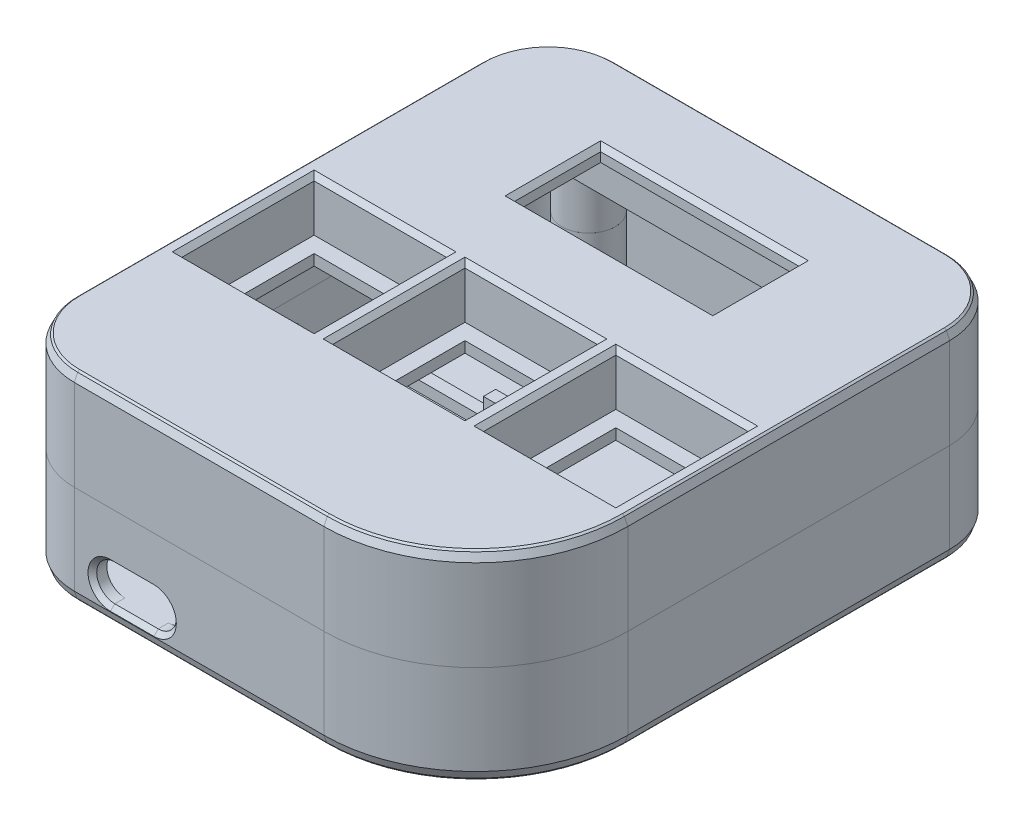
from build123d import *
from OCP.BRepFilletAPI import BRepFilletAPI_MakeChamfer

# Parameters (mm, degrees)
SKETCH2_W                                      = 65
SKETCH2_H                                      = 75
BODY_EXTRUDE_DEPTH                             = 27.5
SMALL_CORNERS_R                                = 9.5
ACCENT_CORNER_R                                = 21
SHELL1_T                                       = 2
E_MOUNTING_START                               = 5
SKETCH4_R                                      = 1.4
E_MOUNTING_DEPTH                               = 5
SKETCH6_W                                      = 10
SKETCH6_H                                      = 1.7
SKETCH6_W_2                                    = 1.7
SKETCH6_H_2                                    = 9.5
WIRE_ROUTES_DEPTH                              = 2.5
MIC_OPENING_REACH                              = 57.792
SKETCH5_R                                      = 1.25
FRONT_CUTOUTS_REACH                            = 58.734
SKETCH11_W                                     = 27.5
SKETCH11_H                                     = 12
SKETCH11_W_2                                   = 18.4
SKETCH11_H_2                                   = 18.4
SKETCH12_W                                     = 18.4
SKETCH12_H                                     = 18.4
SWITCH_SUPPORTS_DEPTH                          = 5.2
SKETCH13_W                                     = 14
SKETCH13_H                                     = 14
SWITCH_MOUNTS_DEPTH                            = 1.5
SKETCH14_W                                     = 61
SKETCH14_H                                     = 1.2
SCREEN_RETAINERS_DEPTH                         = 4
BED_CHAMFER_SIZE                               = 0.6
BED_CHAMFER_SIZE2                              = 0.715052156
CSK_FOR_M3_FLAT_HEAD_MACHINE_SCREW1_AT_2_COUNT = 2
CSK_FOR_M3_FLAT_HEAD_MACHINE_SCREW1_AT_2_PITCH = 41
CSK_FOR_M3_FLAT_HEAD_MACHINE_SCREW1_AT_3_COUNT = 2
CSK_FOR_M3_FLAT_HEAD_MACHINE_SCREW1_AT_3_PITCH = 71.676438543
USB_C_REACH                                    = 86.507
SCREW_POSTS_REACH                              = 57.792
SKETCH8_R                                      = 3.7
SKETCH8_R_2                                    = 1.7
POST_CHAMFERS_SIZE                             = 4.65
POST_CHAMFERS_SIZE_2                           = 1
POWER_SWITCH_SLOT_REACH                        = 80.304
SKETCH17_W                                     = 5.8
SKETCH17_H                                     = 4.8
SWITCH_SPACER_DEPTH                            = 3.4
SWITCH_MOUNT_DEPTH                             = 7
SKETCH23_W                                     = 1.4
SKETCH23_H                                     = 12.4
SWITCH_RETAINER_1_DEPTH                        = 2.5
SWITCH_RETAINER_2_DEPTH                        = 0.4
INTERNAL_CHAMFERS_SIZE                         = 1
PORT_CHAMFER_SIZE                              = 0.6
SKETCH27_R                                     = 2.5
HEATSET_INSERTS_DEPTH                          = 11.75


with BuildPart() as part:
    # Sketch2 → Body Extrude (new body)
    with BuildSketch(Plane(origin=(0, 0, 0), x_dir=(1, 0, 0), z_dir=(0, 1, 0))):
        Rectangle(SKETCH2_W, SKETCH2_H)
    extrude(amount=BODY_EXTRUDE_DEPTH)

    # Small Corners
    small_corners_edges = [part.edges().sort_by_distance(p)[0] for p in [
        (-32.5, 13.75, 37.5),
        (-32.5, 13.75, -37.5),
        (32.5, 13.75, -37.5),
    ]]
    fillet(small_corners_edges, radius=SMALL_CORNERS_R)

    # Accent Corner
    accent_corner_edges = [part.edges().sort_by_distance(p)[0] for p in [
        (32.5, 13.75, 37.5),
    ]]
    fillet(accent_corner_edges, radius=ACCENT_CORNER_R)

    # Shell1 (no face opened: a closed hollow body)
    add(offset(amount=-SHELL1_T, mode=Mode.PRIVATE), mode=Mode.SUBTRACT)

    # Sketch4 → E-Mounting (add)
    with BuildSketch(Plane(origin=(0, 2, 0), x_dir=(1, 0, 0), z_dir=(0, 1, 0)).offset(E_MOUNTING_START)):
        with Locations(Location((-22.575, 23.5, 0), (0, 0, 90))):
            Circle(SKETCH4_R)
        with Locations(Location((-12.125, 23.5, 0), (0, 0, 90))):
            Circle(SKETCH4_R)
        with BuildLine():
            Line((-7, 27.2), (-5.3, 27.2))
            Line((-5.3, 27.2), (-5.3, -35.5))
            Line((-5.3, -35.5), (-7, -35.5))
            Line((-7, -35.5), (-7, -13.928416147))
            Line((-7, -13.928416147), (-25.2, -13.928416147))
            Line((-25.2, -13.928416147), (-25.2, -35.170076708))
            ThreePointArc((-25.2, -35.170076708), (-29.031169041, -32.458138625), (-30.5, -28))
            Line((-30.5, -28), (-30.5, -12.228416147))
            Line((-30.5, -12.228416147), (-7, -12.228416147))
            Line((-7, -12.228416147), (-7, 8.4))
            Line((-7, 8.4), (-30.5, 8.4))
            Line((-30.5, 8.4), (-30.5, 10.1))
            Line((-30.5, 10.1), (-7, 10.1))
            Line((-7, 10.1), (-7, 27.2))
        make_face()
        with BuildLine():
            Line((25.2, 27.2), (26.9, 27.2))
            Line((26.9, 27.2), (26.9, -27.628342195))
            ThreePointArc((26.9, -27.628342195), (26.085582413, -28.676238568), (25.2, -29.664725595))
            Line((25.2, -29.664725595), (25.2, 27.2))
        make_face()
    extrude(amount=-E_MOUNTING_DEPTH)

    # Sketch6 → Wire Routes (cut)
    with BuildSketch(Plane(origin=(0, 7, 0), x_dir=(1, 0, 0), z_dir=(0, 1, 0))):
        with Locations((-16.1, -13.078416147)):
            Rectangle(SKETCH6_W, SKETCH6_H)
        with Locations((-6.15, -30.75)):
            Rectangle(SKETCH6_W_2, SKETCH6_H_2)
        with Locations((-17.35, 9.25)):
            Rectangle(SKETCH6_W, SKETCH6_H)
    extrude(amount=-WIRE_ROUTES_DEPTH, mode=Mode.SUBTRACT)

    # Sketch5 → Mic Opening (cut, up to next)
    with BuildSketch(Plane(origin=(0, 2, 0), x_dir=(1, 0, 0), z_dir=(0, 1, 0)), mode=Mode.PRIVATE) as mic_opening_sk1:
        with Locations(Location((-17.35, 23.5, 0), (0, 0, 270))):
            Circle(SKETCH5_R)
    mic_opening_tool1 = extrude(mic_opening_sk1.sketch, amount=-MIC_OPENING_REACH, mode=Mode.PRIVATE) & part.part
    add(mic_opening_tool1.solids().sort_by_distance((-17.35, 2, -23.5))[0], mode=Mode.SUBTRACT)

    # Sketch11 → Front Cutouts (cut, up to next)
    with BuildSketch(Plane(origin=(0, 27.5, 0), x_dir=(1, 0, 0), z_dir=(0, 1, 0)), mode=Mode.PRIVATE) as front_cutouts_sk1:
        with Locations((0, 20)):
            Rectangle(SKETCH11_W, SKETCH11_H)
    front_cutouts_tool1 = extrude(front_cutouts_sk1.sketch, amount=-FRONT_CUTOUTS_REACH, mode=Mode.PRIVATE) & part.part
    # Sketch11 → Front Cutouts (cut, up to next)
    with BuildSketch(Plane(origin=(0, 27.5, 0), x_dir=(1, 0, 0), z_dir=(0, 1, 0)), mode=Mode.PRIVATE) as front_cutouts_sk2:
        with Locations((-20.85, -6.5)):
            Rectangle(SKETCH11_W_2, SKETCH11_H_2)
    front_cutouts_tool2 = extrude(front_cutouts_sk2.sketch, amount=-FRONT_CUTOUTS_REACH, mode=Mode.PRIVATE) & part.part
    # Sketch11 → Front Cutouts (cut, up to next)
    with BuildSketch(Plane(origin=(0, 27.5, 0), x_dir=(1, 0, 0), z_dir=(0, 1, 0)), mode=Mode.PRIVATE) as front_cutouts_sk3:
        with Locations((0, -6.5)):
            Rectangle(SKETCH11_W_2, SKETCH11_H_2)
    front_cutouts_tool3 = extrude(front_cutouts_sk3.sketch, amount=-FRONT_CUTOUTS_REACH, mode=Mode.PRIVATE) & part.part
    # Sketch11 → Front Cutouts (cut, up to next)
    with BuildSketch(Plane(origin=(0, 27.5, 0), x_dir=(1, 0, 0), z_dir=(0, 1, 0)), mode=Mode.PRIVATE) as front_cutouts_sk4:
        with Locations((20.85, -6.5)):
            Rectangle(SKETCH11_W_2, SKETCH11_H_2)
    front_cutouts_tool4 = extrude(front_cutouts_sk4.sketch, amount=-FRONT_CUTOUTS_REACH, mode=Mode.PRIVATE) & part.part
    add(front_cutouts_tool1.solids().sort_by_distance((0, 27.5, -20))[0], mode=Mode.SUBTRACT)
    add(front_cutouts_tool2.solids().sort_by_distance((-20.85, 27.5, 6.5))[0], mode=Mode.SUBTRACT)
    add(front_cutouts_tool3.solids().sort_by_distance((0, 27.5, 6.5))[0], mode=Mode.SUBTRACT)
    add(front_cutouts_tool4.solids().sort_by_distance((20.85, 27.5, 6.5))[0], mode=Mode.SUBTRACT)

    # Sketch12 → Switch Supports (add)
    with BuildSketch(Plane.XZ.offset(-25.5)):
        with BuildLine():
            Line((-30.5, 18.2), (-30.5, -5.2))
            Line((-30.5, -5.2), (30.5, -5.2))
            Line((30.5, -5.2), (30.5, 16.5))
            ThreePointArc((30.5, 16.5), (30.480939075, 17.350853582), (30.423794545, 18.2))
            Line((30.423794545, 18.2), (-30.5, 18.2))
        make_face()
        with Locations((-20.85, 6.5)):
            Rectangle(SKETCH12_W, SKETCH12_H, mode=Mode.SUBTRACT)
        with Locations((0, 6.5)):
            Rectangle(SKETCH12_W, SKETCH12_H, mode=Mode.SUBTRACT)
        with Locations((20.85, 6.5)):
            Rectangle(SKETCH12_W, SKETCH12_H, mode=Mode.SUBTRACT)
    extrude(amount=SWITCH_SUPPORTS_DEPTH)

    # Sketch13 → Switch Mounts (add)
    with BuildSketch(Plane.XZ.offset(-20.3)):
        with BuildLine():
            Line((-30.5, -5.2), (30.5, -5.2))
            Line((30.5, -5.2), (30.5, 16.5))
            ThreePointArc((30.5, 16.5), (30.480939075, 17.350853582), (30.423794545, 18.2))
            Line((30.423794545, 18.2), (-30.5, 18.2))
            Line((-30.5, 18.2), (-30.5, -5.2))
        make_face()
        with Locations((-20.85, 6.5)):
            Rectangle(SKETCH13_W, SKETCH13_H, mode=Mode.SUBTRACT)
        with Locations((0, 6.5)):
            Rectangle(SKETCH13_W, SKETCH13_H, mode=Mode.SUBTRACT)
        with Locations((20.85, 6.5)):
            Rectangle(SKETCH13_W, SKETCH13_H, mode=Mode.SUBTRACT)
    extrude(amount=SWITCH_MOUNTS_DEPTH)

    # Sketch14 → Screen Retainers (add)
    with BuildSketch(Plane.XZ.offset(-25.5)):
        with Locations((0, -13.2)):
            Rectangle(SKETCH14_W, SKETCH14_H)
        with Locations((0, -26.8)):
            Rectangle(SKETCH14_W, SKETCH14_H)
    extrude(amount=SCREEN_RETAINERS_DEPTH)

    # Bed Chamfer: one chamfer whose edges measure the first distance from different faces: ONE call of the kernel's chamfer builder (chamfer() names one face for all edges)
    bed_chamfer_edges_1 = [part.edges().sort_by_distance(p)[0] for p in [
        (0, 0, -37.5),
        (-5.75, 0, 37.5),
        (-32.5, 0, 0),
        (-29.717514421, 0, -34.717514421),
        (-29.717514421, 0, 34.717514421),
        (29.717514421, 0, -34.717514421),
        (32.5, 0, -5.75),
        (26.349242405, 0, 31.349242405),
    ]]
    bed_chamfer_side_1 = [part.faces().sort_by_distance(p)[0] for p in [
        (-0.41513385, 0, -0.488516013),
    ]]
    bed_chamfer_edges_2 = [part.edges().sort_by_distance(p)[0] for p in [
        (0, 27.5, -37.5),
    ]]
    bed_chamfer_side_2 = [part.faces().sort_by_distance(p)[0] for p in [
        (0, 13.75, -37.5),
    ]]
    bed_chamfer_edges_3 = [part.edges().sort_by_distance(p)[0] for p in [
        (-17.35, 0, -24.75),
    ]]
    bed_chamfer_side_3 = [part.faces().sort_by_distance(p)[0] for p in [
        (-17.35, 1, -24.75),
    ]]
    bed_chamfer_edges_4 = [part.edges().sort_by_distance(p)[0] for p in [
        (-13.75, 27.5, -20),
        (0, 27.5, -14),
        (13.75, 27.5, -20),
        (0, 27.5, -26),
        (-30.05, 27.5, 6.5),
        (-20.85, 27.5, 15.7),
        (-11.65, 27.5, 6.5),
        (-20.85, 27.5, -2.7),
        (-9.2, 27.5, 6.5),
        (0, 27.5, 15.7),
        (9.2, 27.5, 6.5),
        (0, 27.5, -2.7),
        (11.65, 27.5, 6.5),
        (20.85, 27.5, 15.7),
        (30.05, 27.5, 6.5),
        (20.85, 27.5, -2.7),
    ]]
    bed_chamfer_side_4 = [part.faces().sort_by_distance(p)[0] for p in [
        (-5.75, 27.5, 36.507528338),
    ]]
    bed_chamfer_edges_5 = [part.edges().sort_by_distance(p)[0] for p in [
        (-32.5, 27.5, 0),
    ]]
    bed_chamfer_side_5 = [part.faces().sort_by_distance(p)[0] for p in [
        (-32.5, 13.75, 0),
    ]]
    bed_chamfer_edges_6 = [part.edges().sort_by_distance(p)[0] for p in [
        (-5.75, 27.5, 37.5),
    ]]
    bed_chamfer_side_6 = [part.faces().sort_by_distance(p)[0] for p in [
        (-5.75, 13.75, 37.5),
    ]]
    bed_chamfer_edges_7 = [part.edges().sort_by_distance(p)[0] for p in [
        (-29.717514421, 27.5, -34.717514421),
    ]]
    bed_chamfer_side_7 = [part.faces().sort_by_distance(p)[0] for p in [
        (-29.717514421, 13.75, -34.717514421),
    ]]
    bed_chamfer_edges_8 = [part.edges().sort_by_distance(p)[0] for p in [
        (-29.717514421, 27.5, 34.717514421),
    ]]
    bed_chamfer_side_8 = [part.faces().sort_by_distance(p)[0] for p in [
        (-29.717514421, 13.75, 34.717514421),
    ]]
    bed_chamfer_edges_9 = [part.edges().sort_by_distance(p)[0] for p in [
        (29.717514421, 27.5, -34.717514421),
    ]]
    bed_chamfer_side_9 = [part.faces().sort_by_distance(p)[0] for p in [
        (29.717514421, 13.75, -34.717514421),
    ]]
    bed_chamfer_edges_10 = [part.edges().sort_by_distance(p)[0] for p in [
        (32.5, 27.5, -5.75),
    ]]
    bed_chamfer_side_10 = [part.faces().sort_by_distance(p)[0] for p in [
        (32.5, 13.75, -5.75),
    ]]
    bed_chamfer_edges_11 = [part.edges().sort_by_distance(p)[0] for p in [
        (26.349242405, 27.5, 31.349242405),
    ]]
    bed_chamfer_side_11 = [part.faces().sort_by_distance(p)[0] for p in [
        (26.349242405, 13.75, 31.349242405),
    ]]
    bed_chamfer = BRepFilletAPI_MakeChamfer(part.part.solid().wrapped)
    for e in bed_chamfer_edges_1:
        bed_chamfer.Add(BED_CHAMFER_SIZE, BED_CHAMFER_SIZE2, e.wrapped, bed_chamfer_side_1[0].wrapped)  # the first distance lies on this face
    for e in bed_chamfer_edges_2:
        bed_chamfer.Add(BED_CHAMFER_SIZE, BED_CHAMFER_SIZE2, e.wrapped, bed_chamfer_side_2[0].wrapped)  # the first distance lies on this face
    for e in bed_chamfer_edges_3:
        bed_chamfer.Add(BED_CHAMFER_SIZE, BED_CHAMFER_SIZE2, e.wrapped, bed_chamfer_side_3[0].wrapped)  # the first distance lies on this face
    for e in bed_chamfer_edges_4:
        bed_chamfer.Add(BED_CHAMFER_SIZE, BED_CHAMFER_SIZE2, e.wrapped, bed_chamfer_side_4[0].wrapped)  # the first distance lies on this face
    for e in bed_chamfer_edges_5:
        bed_chamfer.Add(BED_CHAMFER_SIZE, BED_CHAMFER_SIZE2, e.wrapped, bed_chamfer_side_5[0].wrapped)  # the first distance lies on this face
    for e in bed_chamfer_edges_6:
        bed_chamfer.Add(BED_CHAMFER_SIZE, BED_CHAMFER_SIZE2, e.wrapped, bed_chamfer_side_6[0].wrapped)  # the first distance lies on this face
    for e in bed_chamfer_edges_7:
        bed_chamfer.Add(BED_CHAMFER_SIZE, BED_CHAMFER_SIZE2, e.wrapped, bed_chamfer_side_7[0].wrapped)  # the first distance lies on this face
    for e in bed_chamfer_edges_8:
        bed_chamfer.Add(BED_CHAMFER_SIZE, BED_CHAMFER_SIZE2, e.wrapped, bed_chamfer_side_8[0].wrapped)  # the first distance lies on this face
    for e in bed_chamfer_edges_9:
        bed_chamfer.Add(BED_CHAMFER_SIZE, BED_CHAMFER_SIZE2, e.wrapped, bed_chamfer_side_9[0].wrapped)  # the first distance lies on this face
    for e in bed_chamfer_edges_10:
        bed_chamfer.Add(BED_CHAMFER_SIZE, BED_CHAMFER_SIZE2, e.wrapped, bed_chamfer_side_10[0].wrapped)  # the first distance lies on this face
    for e in bed_chamfer_edges_11:
        bed_chamfer.Add(BED_CHAMFER_SIZE, BED_CHAMFER_SIZE2, e.wrapped, bed_chamfer_side_11[0].wrapped)  # the first distance lies on this face
    add(Compound.cast(bed_chamfer.Shape()), mode=Mode.REPLACE)

    # Sketch7 → CSK for M3 Flat Head Machine Screw1 (revolve, cut)
    with BuildSketch(Plane(origin=(-20.5, 0, -31.076084879), x_dir=(0, 0, -1), z_dir=(1, 0, 0))):
        Polygon((0, 0), (0, 2), (1.7, 2), (1.7, 1.45), (3.15, 0), align=None)
    csk_for_m3_flat_head_machine_screw1 = revolve(axis=Axis((-20.5, -6.35, -31.076084879), (0, 1, 0)), mode=Mode.SUBTRACT)

    # CSK for M3 Flat Head Machine Screw1 at 2: CSK for M3 Flat Head Machine Screw1 ×2
    with Locations(*[(i * CSK_FOR_M3_FLAT_HEAD_MACHINE_SCREW1_AT_2_PITCH, 0, 0) for i in range(1, CSK_FOR_M3_FLAT_HEAD_MACHINE_SCREW1_AT_2_COUNT)]):
        add(csk_for_m3_flat_head_machine_screw1, mode=Mode.SUBTRACT)

    # CSK for M3 Flat Head Machine Screw1 at 3: CSK for M3 Flat Head Machine Screw1 ×2
    with Locations(*[Vector(0.49528130472774157, 0, 0.868732656913038) * (i * CSK_FOR_M3_FLAT_HEAD_MACHINE_SCREW1_AT_3_PITCH) for i in range(1, CSK_FOR_M3_FLAT_HEAD_MACHINE_SCREW1_AT_3_COUNT)]):
        add(csk_for_m3_flat_head_machine_screw1, mode=Mode.SUBTRACT)

    # Sketch10 → USB-C (cut, up to next)
    with BuildSketch(Plane(origin=(0, 0, 35.5), x_dir=(-1, 0, 0), z_dir=(0, 0, -1)), mode=Mode.PRIVATE) as usb_c_sk1:
        with BuildLine():
            Line((12, 7), (18, 7))
            ThreePointArc((18, 7), (20.5, 4.5), (18, 2))
            Line((18, 2), (12, 2))
            ThreePointArc((12, 2), (9.5, 4.5), (12, 7))
        make_face()
    usb_c_tool1 = extrude(usb_c_sk1.sketch, amount=-USB_C_REACH, mode=Mode.PRIVATE) & part.part
    add(usb_c_tool1.solids().sort_by_distance((-15, 4.5, 35.5))[0], mode=Mode.SUBTRACT)

    # Sketch8 → Screw Posts (add, up to next)
    with BuildSketch(Plane(origin=(0, 2, 0), x_dir=(1, 0, 0), z_dir=(0, 1, 0)), mode=Mode.PRIVATE) as screw_posts_sk1:
        with Locations(Location((20.5, 31.076084879, 0), (0, 0, 90))):
            Circle(SKETCH8_R)
        with Locations(Location((20.5, 31.076084879, 0), (0, 0, 90))):
            Circle(SKETCH8_R_2, mode=Mode.SUBTRACT)
    screw_posts_tool1 = extrude(screw_posts_sk1.sketch, amount=SCREW_POSTS_REACH, mode=Mode.PRIVATE) - part.part
    # Sketch8 → Screw Posts (add, up to next)
    with BuildSketch(Plane(origin=(0, 2, 0), x_dir=(1, 0, 0), z_dir=(0, 1, 0)), mode=Mode.PRIVATE) as screw_posts_sk2:
        with Locations(Location((15, -31.191578015, 0), (0, 0, 90))):
            Circle(SKETCH8_R)
        with Locations(Location((15, -31.191578015, 0), (0, 0, 90))):
            Circle(SKETCH8_R_2, mode=Mode.SUBTRACT)
    screw_posts_tool2 = extrude(screw_posts_sk2.sketch, amount=SCREW_POSTS_REACH, mode=Mode.PRIVATE) - part.part
    # Sketch8 → Screw Posts (add, up to next)
    with BuildSketch(Plane(origin=(0, 2, 0), x_dir=(1, 0, 0), z_dir=(0, 1, 0)), mode=Mode.PRIVATE) as screw_posts_sk3:
        with Locations(Location((-20.5, 31.076084879, 0), (0, 0, 90))):
            Circle(SKETCH8_R)
        with Locations(Location((-20.5, 31.076084879, 0), (0, 0, 90))):
            Circle(SKETCH8_R_2, mode=Mode.SUBTRACT)
    screw_posts_tool3 = extrude(screw_posts_sk3.sketch, amount=SCREW_POSTS_REACH, mode=Mode.PRIVATE) - part.part
    add(screw_posts_tool1.solids().sort_by_distance((20.5, 2, -27.480737))[0])
    add(screw_posts_tool2.solids().sort_by_distance((15, 2, 34.786926))[0])
    add(screw_posts_tool3.solids().sort_by_distance((-20.5, 2, -27.480737))[0])

    # Post Chamfers
    # the kernel refuses this chamfer: 4.65, 1 mm, written as the material it adds along each edge
    with BuildSketch(Plane(origin=(20.5, 25.5, -31.076084879), x_dir=(0, 0, -1), z_dir=(-1, 0, 0))) as post_chamfers_piece_1_section:
        Polygon((3.7, POST_CHAMFERS_SIZE), (3.7 + POST_CHAMFERS_SIZE_2, 0), (3.7, 0), align=None)
    post_chamfers_piece_1 = revolve(axis=Axis((20.5, 25.5, -31.076084879), (0, -1, 0)), revolution_arc=359.64, mode=Mode.PRIVATE)
    post_chamfers_piece_1 = split(post_chamfers_piece_1, bisect_by=Plane(origin=(23.790006499, 21.512228263, -27.4), z_dir=(0, 0, -1)), keep=Keep.TOP, mode=Mode.PRIVATE)
    add(post_chamfers_piece_1)
    with BuildSketch(Plane(origin=(20.5, 25.5, -31.076084879), x_dir=(0, 0, -1), z_dir=(-1, 0, 0))) as post_chamfers_piece_2_section:
        Polygon((3.7, POST_CHAMFERS_SIZE), (3.7 + POST_CHAMFERS_SIZE_2, 0), (3.7, 0), align=None)
    post_chamfers_piece_2 = revolve(axis=Axis((20.5, 25.5, -31.076084879), (0, -1, 0)), revolution_arc=359.64, mode=Mode.PRIVATE)
    post_chamfers_piece_2 = split(post_chamfers_piece_2, bisect_by=Plane(origin=(20.5, 24.260006858, -27.4), z_dir=(0, 0, 1)), keep=Keep.TOP, mode=Mode.PRIVATE)
    add(post_chamfers_piece_2)
    with BuildSketch(Plane(origin=(-20.5, 25.5, -31.076084879), x_dir=(0, 0, -1), z_dir=(-1, 0, 0))) as post_chamfers_piece_3_section:
        Polygon((3.7 + POST_CHAMFERS_SIZE_2, 0), (3.7, POST_CHAMFERS_SIZE), (3.7, 0), align=None)
    post_chamfers_piece_3 = revolve(axis=Axis((-20.5, 25.5, -31.076084879), (0, -1, 0)), revolution_arc=359.64, mode=Mode.PRIVATE)
    post_chamfers_piece_3 = split(post_chamfers_piece_3, bisect_by=Plane(origin=(-16.587864302, 24.854685044, -27.4), z_dir=(0, 0, -1)), keep=Keep.TOP, mode=Mode.PRIVATE)
    add(post_chamfers_piece_3)
    with BuildSketch(Plane(origin=(-20.5, 25.5, -31.076084879), x_dir=(0, 0, -1), z_dir=(-1, 0, 0))) as post_chamfers_piece_4_section:
        Polygon((3.7 + POST_CHAMFERS_SIZE_2, 0), (3.7, POST_CHAMFERS_SIZE), (3.7, 0), align=None)
    post_chamfers_piece_4 = revolve(axis=Axis((-20.5, 25.5, -31.076084879), (0, -1, 0)), revolution_arc=359.64, mode=Mode.PRIVATE)
    post_chamfers_piece_4 = split(post_chamfers_piece_4, bisect_by=Plane(origin=(-20.5, 24.260007171, -27.4), z_dir=(0, 0, 1)), keep=Keep.TOP, mode=Mode.PRIVATE)
    add(post_chamfers_piece_4)
    with BuildSketch(Plane(origin=(20.5, 2, -31.076084879), x_dir=(0, 0, -1), z_dir=(1, 0, 0))) as post_chamfers_piece_5:
        Polygon((3.7 + POST_CHAMFERS_SIZE_2, 0), (3.7, POST_CHAMFERS_SIZE), (3.7, 0), align=None)
    revolve(axis=Axis((20.5, 2, -31.076084879), (0, 1, 0)))
    with BuildSketch(Plane(origin=(15, 2, 31.191578015), x_dir=(0, 0, -1), z_dir=(1, 0, 0))) as post_chamfers_piece_6:
        Polygon((3.7 + POST_CHAMFERS_SIZE_2, 0), (3.7, POST_CHAMFERS_SIZE), (3.7, 0), align=None)
    revolve(axis=Axis((15, 2, 31.191578015), (0, 1, 0)))
    with BuildSketch(Plane(origin=(-20.5, 2, -31.076084879), x_dir=(0, 0, -1), z_dir=(1, 0, 0))) as post_chamfers_piece_7:
        Polygon((3.7 + POST_CHAMFERS_SIZE_2, 0), (3.7, POST_CHAMFERS_SIZE), (3.7, 0), align=None)
    revolve(axis=Axis((-20.5, 2, -31.076084879), (0, 1, 0)))
    with BuildSketch(Plane(origin=(15, 25.5, 31.191578015), x_dir=(0, 0, -1), z_dir=(-1, 0, 0))) as post_chamfers_piece_8:
        Polygon((3.7, POST_CHAMFERS_SIZE), (3.7 + POST_CHAMFERS_SIZE_2, 0), (3.7, 0), align=None)
    revolve(axis=Axis((15, 25.5, 31.191578015), (0, -1, 0)))
    with BuildSketch(Plane(origin=(-20.5, 25.5, -31.076084879), x_dir=(0.006283143965558952, 0, -0.9999802608561371), z_dir=(-0.9999802608561371, 0, -0.006283143965558952))) as post_chamfers_piece_9_section:
        Polygon((-3.7 - POST_CHAMFERS_SIZE_2, 0), (-3.7, POST_CHAMFERS_SIZE), (-3.7, 0), align=None)
    post_chamfers_piece_9 = revolve(axis=Axis((-20.5, 25.5, -31.076084879), (0, -1, 0)), revolution_arc=359.64, mode=Mode.PRIVATE)
    post_chamfers_piece_9 = split(post_chamfers_piece_9, bisect_by=Plane(origin=(-20.486985966, 23.18736508, -27.4), z_dir=(0, 0, -1)), keep=Keep.TOP, mode=Mode.PRIVATE)
    add(post_chamfers_piece_9)
    with BuildSketch(Plane(origin=(20.5, 25.5, -31.076084879), x_dir=(0.006283143965559912, 0, -0.9999802608561371), z_dir=(-0.9999802608561371, 0, -0.006283143965559912))) as post_chamfers_piece_10_section:
        Polygon((-3.7, POST_CHAMFERS_SIZE), (-3.7 - POST_CHAMFERS_SIZE_2, 0), (-3.7, 0), align=None)
    post_chamfers_piece_10 = revolve(axis=Axis((20.5, 25.5, -31.076084879), (0, -1, 0)), revolution_arc=359.64, mode=Mode.PRIVATE)
    post_chamfers_piece_10 = split(post_chamfers_piece_10, bisect_by=Plane(origin=(20.513014034, 23.18736508, -27.4), z_dir=(0, 0, -1)), keep=Keep.TOP, mode=Mode.PRIVATE)
    add(post_chamfers_piece_10)

    # Sketch17 → Power Switch Slot (cut, up to next)
    with BuildSketch(Plane(origin=(-30.5, 0, 0), x_dir=(0, 0, -1), z_dir=(1, 0, 0)), mode=Mode.PRIVATE) as power_switch_slot_sk1:
        with Locations((-2, 8)):
            Rectangle(SKETCH17_W, SKETCH17_H)
    power_switch_slot_tool1 = extrude(power_switch_slot_sk1.sketch, amount=-POWER_SWITCH_SLOT_REACH, mode=Mode.PRIVATE) & part.part
    add(power_switch_slot_tool1.solids().sort_by_distance((-30.5, 8, 2))[0], mode=Mode.SUBTRACT)

    # Sketch21 → Switch Spacer (add)
    with BuildSketch(Plane(origin=(-30.5, 0, 0), x_dir=(0, 0, -1), z_dir=(1, 0, 0))):
        Polygon((-8.2, 8), (-4, 8), (-4, 6), (0, 6), (0, 8), (4.2, 8), (4.2, 2), (-8.2, 2), align=None)
    extrude(amount=SWITCH_SPACER_DEPTH)

    # Sketch20 → Switch Mount (add)
    with BuildSketch(Plane(origin=(-27.1, 0, 0), x_dir=(0, 0, -1), z_dir=(1, 0, 0))):
        Polygon((-5.7, 8), (-8.2, 8), (-8.2, 2), (4.2, 2), (4.2, 8), (1.7, 8), (1.7, 4.5), (-5.7, 4.5), align=None)
    extrude(amount=SWITCH_MOUNT_DEPTH)

    # Sketch23 → Switch Retainer-1 (add)
    with BuildSketch(Plane(origin=(0, 2, 0), x_dir=(1, 0, 0), z_dir=(0, 1, 0))):
        with Locations((-19.4, -2)):
            Rectangle(SKETCH23_W, SKETCH23_H)
    extrude(amount=SWITCH_RETAINER_1_DEPTH)

    # Sketch24 → Switch Retainer-2 (add)
    with BuildSketch(Plane(origin=(0, 4.5, 0), x_dir=(1, 0, 0), z_dir=(0, 1, 0))):
        Polygon((-20.1, 1.7), (-19.9, 1.7), (-19.9, -5.7), (-20.1, -5.7), (-20.1, -8.2), (-18.7, -8.2), (-18.7, 4.2), (-20.1, 4.2), align=None)
    extrude(amount=SWITCH_RETAINER_2_DEPTH)

    # Internal Chamfers
    internal_chamfers_edges = [part.edges().sort_by_distance(p)[0] for p in [
        (26.964274561, 25.5, -27.4),
        (-26.964274561, 25.5, -27.4),
        (0, 25.5, -27.4),
        (0, 25.5, -12.6),
        (-0.038102727, 25.5, 18.2),
        (0, 25.5, -5.2),
        (-18.75, 2, 12.228416147),
        (-18.75, 2, -8.4),
        (26.9, 2, 0.214171097),
        (-7, 2, 1.914208074),
        (-24.6, 2, -4.2),
        (-18.7, 2, 2),
        (-24.6, 2, 8.2),
    ]]
    chamfer(internal_chamfers_edges, length=INTERNAL_CHAMFERS_SIZE)

    # Port Chamfer
    port_chamfer_edges = [part.edges().sort_by_distance(p)[0] for p in [
        (-29.717514421, 0.715052156, 34.717514421),
        (-29.717514421, 26.9, 34.717514421),
        (-32.5, 0.715052156, 0),
        (-32.5, 26.9, 0),
        (-29.717514421, 0.715052156, -34.717514421),
        (-29.717514421, 26.9, -34.717514421),
        (0, 0.715052156, -37.5),
        (0, 26.9, -37.5),
        (29.717514421, 0.715052156, -34.717514421),
        (29.717514421, 26.9, -34.717514421),
        (32.5, 0.715052156, -5.75),
        (32.5, 26.9, -5.75),
        (26.349242405, 0.715052156, 31.349242405),
        (26.349242405, 26.9, 31.349242405),
        (-5.75, 0.715052156, 37.5),
        (-5.75, 26.9, 37.5),
        (-15, 7, 37.5),
        (-15, 2, 37.5),
        (-9.5, 4.5, 37.5),
        (-20.5, 4.5, 37.5),
        (-32.5, 8, 4.9),
        (-32.5, 10.4, 2),
        (-32.5, 8, -0.9),
        (-32.5, 5.6, 2),
    ]]
    chamfer(port_chamfer_edges, length=PORT_CHAMFER_SIZE)

    # Sketch27 → Heatset Inserts (cut)
    with BuildSketch(Plane(origin=(0, 13.75, 0), x_dir=(1, 0, 0), z_dir=(0, 1, 0))):
        with Locations(Location((20.5, 31.076084879, 0), (0, 0, 90))):
            Circle(SKETCH27_R)
        with Locations(Location((15, -31.191578015, 0), (0, 0, 90))):
            Circle(SKETCH27_R)
        with Locations(Location((-20.5, 31.076084879, 0), (0, 0, 90))):
            Circle(SKETCH27_R)
    extrude(amount=HEATSET_INSERTS_DEPTH, mode=Mode.SUBTRACT)


with BuildPart() as body_2:
    # Split2: the piece on the far side of the plane
    add(part.part)
    split(bisect_by=Plane.ZX.offset(13.75), keep=Keep.BOTTOM)


with BuildPart() as part_1:
    add(part.part)

    # Split2
    split(bisect_by=Plane.ZX.offset(13.75), keep=Keep.TOP)


solid = Compound([body_2.part, part_1.part])
